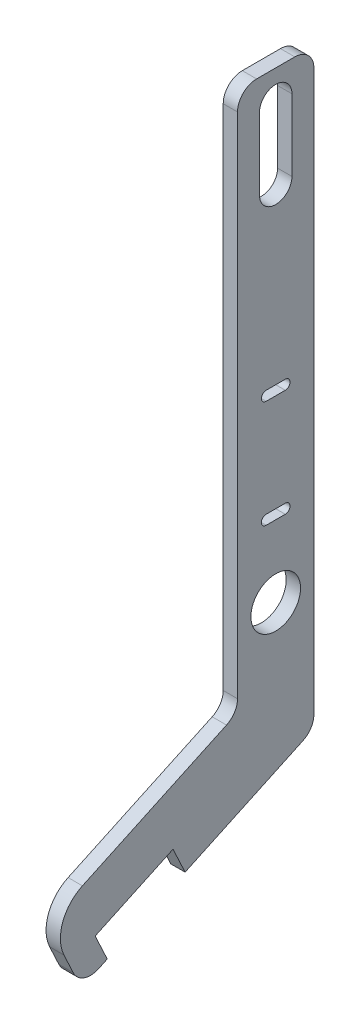
from build123d import *

# Parameters (mm, degrees)
SKETCH1_R            = 2.6
BASE_FLANGE1_DEPTH   = 1.5
KEYING_DEPTH         = 10
FILLET1_R            = 2
FILLET2_R            = 4
JOG1_START           = -34.826317149
JOG1_DEPTH           = 8
JOG1_START_2         = -32.826317149
JOG1_2_DEPTH         = 0.3
JOG1_START_3         = -29.126317149
JOG1_3_DEPTH         = 0.3
JOG1_4_DEPTH         = 8
JOG1_START_4         = -13.5
JOG1_5_DEPTH         = 1.5
CUT_EXTRUDE1_START   = -13.5
CUT_EXTRUDE1_DEPTH   = 12
CUT_EXTRUDE1_START_2 = -1.5
CUT_EXTRUDE1_2_DEPTH = 1.5
CUT_EXTRUDE1_3_DEPTH = 1.5


with BuildPart() as part:
    # Base-Flange1: sheet metal written as solids
    # Sketch1 → Base-Flange1 (new body)
    with BuildSketch(Plane(origin=(0, 0, 0), x_dir=(0, 0, -1), z_dir=(1, 0, 0))):
        Polygon((34.826317149, 21.8), (34.826317149, 63.8), (26.826317149, 63.8), (26.826317149, 17.789661718), (6.95251297, 8.522354632), (9.826317149, 2.359461681), (10.460244542, 1), (34.826317149, 12.362086256), align=None)
        with Locations((30.826317149, 25.8)):
            Circle(SKETCH1_R, mode=Mode.SUBTRACT)
        with BuildLine():
            Line((32.526317149, 60.6), (32.526317149, 53.1))
            ThreePointArc((32.526317149, 53.1), (30.826317149, 51.4), (29.126317149, 53.1))
            Line((29.126317149, 53.1), (29.126317149, 60.6))
            ThreePointArc((29.126317149, 60.6), (30.826317149, 62.3), (32.526317149, 60.6))
        make_face(mode=Mode.SUBTRACT)
    extrude(amount=-BASE_FLANGE1_DEPTH)

    # Sketch6 → Keying (cut)
    with BuildSketch(Plane(origin=(0, 0, 0), x_dir=(0, 0, -1), z_dir=(1, 0, 0))):
        Polygon((21.335937987, 6.071419141), (20.068083201, 8.790342502), (11.911313118, 4.986778146), (13.179167903, 2.267854785), (16.260435533, 3.704673478), align=None)
    extrude(amount=-KEYING_DEPTH, mode=Mode.SUBTRACT)

    # Fillet1
    fillet1_edges = [part.edges().sort_by_distance(p)[0] for p in [
        (-0.75, 12.362086256, -34.826317149),
        (-0.75, 1, -10.460244542),
        (-0.75, 17.789661718, -26.826317149),
        (-0.75, 63.8, -26.826317149),
        (-0.75, 63.8, -34.826317149),
    ]]
    fillet(fillet1_edges, radius=FILLET1_R)

    # Fillet2
    fillet2_edges = [part.edges().sort_by_distance(p)[0] for p in [
        (-0.75, 8.522354632, -6.95251297),
    ]]
    fillet(fillet2_edges, radius=FILLET2_R)

    # Jog1: read off the stored shape, not the designer's step
    # Jog1 outline → Jog1 (cut)
    with BuildSketch(Plane.XY.offset(JOG1_START)):
        with BuildLine():
            Line((-1.5, 63.8), (-1.5, 34.716841062))
            ThreePointArc((-1.5, 34.716841062), (-0.408349934, 33.794859608), (0, 32.425553214))
            Line((0, 32.425553214), (0, 63.8))
            Line((0, 63.8), (-1.5, 63.8))
        make_face()
    extrude(amount=JOG1_DEPTH, mode=Mode.SUBTRACT)

    # Jog1 2 outline → Jog1 2 (add)
    with BuildSketch(Plane.XY.offset(JOG1_START_2)):
        with BuildLine():
            ThreePointArc((-1.5, 34.716841062), (-1.989225891, 34.872818996), (-2.5, 34.925553214))
            Line((-2.5, 34.925553214), (-11, 34.925553214))
            ThreePointArc((-11, 34.925553214), (-11.707106781, 35.218446433), (-12, 35.925553214))
            Line((-12, 35.925553214), (-12, 63.8))
            Line((-12, 63.8), (-13.5, 63.8))
            Line((-13.5, 63.8), (-13.5, 35.925553214))
            ThreePointArc((-13.5, 35.925553214), (-12.767766953, 34.157786261), (-11, 33.425553214))
            Line((-11, 33.425553214), (-2.5, 33.425553214))
            ThreePointArc((-2.5, 33.425553214), (-1.792893219, 33.132659995), (-1.5, 32.425553214))
            Line((-1.5, 32.425553214), (-1.5, 34.716841062))
        make_face()
    extrude(amount=JOG1_2_DEPTH)

    # Jog1 3 outline → Jog1 3 (add)
    with BuildSketch(Plane.XY.offset(JOG1_START_3)):
        with BuildLine():
            ThreePointArc((-1.5, 34.716841062), (-1.989225891, 34.872818996), (-2.5, 34.925553214))
            Line((-2.5, 34.925553214), (-11, 34.925553214))
            ThreePointArc((-11, 34.925553214), (-11.707106781, 35.218446433), (-12, 35.925553214))
            Line((-12, 35.925553214), (-12, 63.8))
            Line((-12, 63.8), (-13.5, 63.8))
            Line((-13.5, 63.8), (-13.5, 35.925553214))
            ThreePointArc((-13.5, 35.925553214), (-12.767766953, 34.157786261), (-11, 33.425553214))
            Line((-11, 33.425553214), (-2.5, 33.425553214))
            ThreePointArc((-2.5, 33.425553214), (-1.792893219, 33.132659995), (-1.5, 32.425553214))
            Line((-1.5, 32.425553214), (-1.5, 34.716841062))
        make_face()
    extrude(amount=JOG1_3_DEPTH)

    # Jog1 4 outline → Jog1 4 (add)
    with BuildSketch(Plane.XY.offset(JOG1_START)):
        with BuildLine():
            ThreePointArc((-1.5, 34.716841062), (-1.989225891, 34.872818996), (-2.5, 34.925553214))
            Line((-2.5, 34.925553214), (-11, 34.925553214))
            ThreePointArc((-11, 34.925553214), (-11.707106781, 35.218446433), (-12, 35.925553214))
            Line((-12, 35.925553214), (-12, 63.8))
            Line((-12, 63.8), (-13.5, 63.8))
            Line((-13.5, 63.8), (-13.5, 35.925553214))
            ThreePointArc((-13.5, 35.925553214), (-12.767766953, 34.157786261), (-11, 33.425553214))
            Line((-11, 33.425553214), (-2.5, 33.425553214))
            ThreePointArc((-2.5, 33.425553214), (-1.792893219, 33.132659995), (-1.5, 32.425553214))
            Line((-1.5, 32.425553214), (-1.5, 34.716841062))
        make_face()
    extrude(amount=JOG1_4_DEPTH)

    # Jog1 5 outline → Jog1 5 (cut)
    with BuildSketch(Plane.YZ.offset(JOG1_START_4)):
        with BuildLine():
            ThreePointArc((61.8, -26.826317149), (63.214213562, -27.412103587), (63.8, -28.826317149))
            Line((63.8, -28.826317149), (63.8, -26.826317149))
            Line((63.8, -26.826317149), (61.8, -26.826317149))
        make_face()
        with BuildLine():
            ThreePointArc((63.8, -32.826317149), (63.214213562, -34.240530711), (61.8, -34.826317149))
            Line((61.8, -34.826317149), (63.8, -34.826317149))
            Line((63.8, -34.826317149), (63.8, -32.826317149))
        make_face()
        with BuildLine():
            Line((60.6, -29.126317149), (53.1, -29.126317149))
            ThreePointArc((53.1, -29.126317149), (51.4, -30.826317149), (53.1, -32.526317149))
            Line((53.1, -32.526317149), (60.6, -32.526317149))
            ThreePointArc((60.6, -32.526317149), (62.3, -30.826317149), (60.6, -29.126317149))
        make_face()
    extrude(amount=JOG1_5_DEPTH, mode=Mode.SUBTRACT)

    # Cut-Extrude1: read off the stored shape, not the designer's step
    # Cut-Extrude1 outline → Cut-Extrude1 (cut)
    with BuildSketch(Plane(origin=(0, 0, 0), x_dir=(0, 0, -1), z_dir=(1, 0, 0)).offset(CUT_EXTRUDE1_START)):
        with BuildLine():
            Line((26.826317149, 31), (34.826317149, 31))
            Line((34.826317149, 31), (34.826317149, 61.8))
            ThreePointArc((34.826317149, 61.8), (34.240530711, 63.214213562), (32.826317149, 63.8))
            Line((32.826317149, 63.8), (28.826317149, 63.8))
            ThreePointArc((28.826317149, 63.8), (27.412103587, 63.214213562), (26.826317149, 61.8))
            Line((26.826317149, 61.8), (26.826317149, 31))
        make_face()
        with BuildLine():
            ThreePointArc((29.126317149, 60.6), (30.826317149, 62.3), (32.526317149, 60.6))
            Line((32.526317149, 60.6), (32.526317149, 53.1))
            ThreePointArc((32.526317149, 53.1), (30.826317149, 51.4), (29.126317149, 53.1))
            Line((29.126317149, 53.1), (29.126317149, 60.6))
        make_face(mode=Mode.SUBTRACT)
    extrude(amount=CUT_EXTRUDE1_DEPTH, mode=Mode.SUBTRACT)

    # Cut-Extrude1 2 outline → Cut-Extrude1 2 (cut)
    with BuildSketch(Plane(origin=(0, 0, 0), x_dir=(0, 0, -1), z_dir=(1, 0, 0)).offset(CUT_EXTRUDE1_START_2)):
        with BuildLine():
            ThreePointArc((29.826317149, 34.3), (29.326317149, 33.8), (29.826317149, 33.3))
            Line((29.826317149, 33.3), (31.826317149, 33.3))
            ThreePointArc((31.826317149, 33.3), (32.326317149, 33.8), (31.826317149, 34.3))
            Line((31.826317149, 34.3), (29.826317149, 34.3))
        make_face()
    extrude(amount=CUT_EXTRUDE1_2_DEPTH, mode=Mode.SUBTRACT)

    # Cut-Extrude1 3 outline → Cut-Extrude1 3 (add)
    with BuildSketch(Plane(origin=(0, 0, 0), x_dir=(0, 0, -1), z_dir=(1, 0, 0)).offset(CUT_EXTRUDE1_START_2)):
        with BuildLine():
            Line((26.826317149, 31), (34.826317149, 31))
            Line((34.826317149, 31), (34.826317149, 72.297787144))
            ThreePointArc((34.826317149, 72.297787144), (34.240530711, 73.712000706), (32.826317149, 74.297787144))
            Line((32.826317149, 74.297787144), (28.826317149, 74.297787144))
            ThreePointArc((28.826317149, 74.297787144), (27.412103587, 73.712000706), (26.826317149, 72.297787144))
            Line((26.826317149, 72.297787144), (26.826317149, 31))
        make_face()
        with BuildLine():
            ThreePointArc((29.826317149, 33.3), (29.326317149, 33.8), (29.826317149, 34.3))
            Line((29.826317149, 34.3), (31.826317149, 34.3))
            ThreePointArc((31.826317149, 34.3), (32.326317149, 33.8), (31.826317149, 33.3))
            Line((31.826317149, 33.3), (29.826317149, 33.3))
        make_face(mode=Mode.SUBTRACT)
        with BuildLine():
            Line((29.826317149, 45.548893572), (31.826317149, 45.548893572))
            ThreePointArc((31.826317149, 45.548893572), (32.326317149, 45.048893572), (31.826317149, 44.548893572))
            Line((31.826317149, 44.548893572), (29.826317149, 44.548893572))
            ThreePointArc((29.826317149, 44.548893572), (29.326317149, 45.048893572), (29.826317149, 45.548893572))
        make_face(mode=Mode.SUBTRACT)
        with BuildLine():
            Line((29.126317149, 63.597787144), (29.126317149, 71.097787144))
            ThreePointArc((29.126317149, 71.097787144), (30.826317149, 72.797787144), (32.526317149, 71.097787144))
            Line((32.526317149, 71.097787144), (32.526317149, 63.597787144))
            ThreePointArc((32.526317149, 63.597787144), (30.826317149, 61.897787144), (29.126317149, 63.597787144))
        make_face(mode=Mode.SUBTRACT)
    extrude(amount=CUT_EXTRUDE1_3_DEPTH)


solid = part.part
